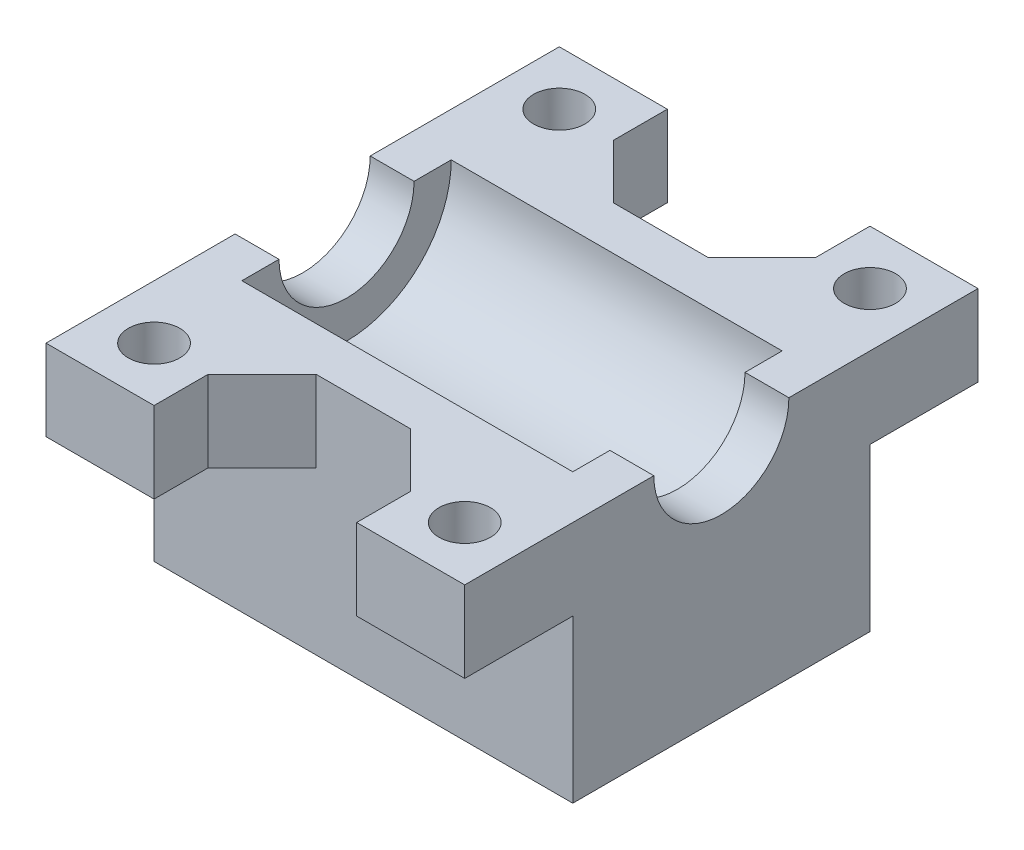
from build123d import *

# Parameters (mm, degrees)
SKETCH1_W                 = 31
SKETCH1_H                 = 22
BOSS_EXTRUDE1_DEPTH       = 11
SKETCH2_W                 = 31
SKETCH2_H                 = 22
SKETCH2_R                 = 4
BOSS_EXTRUDE2_DEPTH       = 7
SKETCH3_W                 = 24.5
SKETCH3_H                 = 15.5
CUT_EXTRUDE1_DEPTH        = 7.75
FILLET1_R                 = 7.75
CUT_EXTRUDE2_DEPTH        = 32.812929761
CUT_EXTRUDE2_DEPTH_BACK   = 32.812929761
SKETCH4_R                 = 5
SKETCH5_W                 = 8
SKETCH5_H                 = 8
SKETCH5_R                 = 1.905800151
BOSS_EXTRUDE3_DEPTH       = 6
CUT_EXTRUDE3_START        = -3
SKETCH6_R                 = 3
SKETCH6_R_2               = 1.905800151
CUT_EXTRUDE3_DEPTH        = 3
MIRROR9_COPY_1_SKETCH_W   = 8
MIRROR9_COPY_1_SKETCH_H   = 8
MIRROR9_COPY_1_SKETCH_R   = 1.905800151
MIRROR9_COPY_1_DEPTH      = 6
MIRROR9_START             = -3
MIRROR9_COPY_2_SKETCH_R   = 3
MIRROR9_COPY_2_SKETCH_R_2 = 1.905800151
MIRROR9_COPY_2_DEPTH      = 3
CHAMFER2_SIZE             = 4
SKETCH7_R                 = 4
BOSS_EXTRUDE4_DEPTH       = 1


with BuildPart() as part:
    # Sketch1 → Boss-Extrude1 (new body)
    with BuildSketch(Plane(origin=(0, 0, 0), x_dir=(1, 0, 0), z_dir=(0, 1, 0))):
        Rectangle(SKETCH1_W, SKETCH1_H)
    extrude(amount=BOSS_EXTRUDE1_DEPTH)

    # Sketch2 → Boss-Extrude2 (add)
    with BuildSketch(Plane(origin=(0, 0, 0), x_dir=(1, 0, 0), z_dir=(0, 1, 0))):
        Rectangle(SKETCH2_W, SKETCH2_H)
        with Locations(Location((0, 0, 0), (0, 0, 270))):
            Circle(SKETCH2_R, mode=Mode.SUBTRACT)
    extrude(amount=-BOSS_EXTRUDE2_DEPTH)

    # Sketch3 → Cut-Extrude1 (cut)
    with BuildSketch(Plane(origin=(0, 11, 0), x_dir=(1, 0, 0), z_dir=(0, 1, 0))):
        Rectangle(SKETCH3_W, SKETCH3_H)
    extrude(amount=-CUT_EXTRUDE1_DEPTH, mode=Mode.SUBTRACT)

    # Fillet1
    fillet1_edges = [part.edges().sort_by_distance(p)[0] for p in [
        (0, 3.25, 7.75),
        (0, 3.25, -7.75),
    ]]
    fillet(fillet1_edges, radius=FILLET1_R - 0.0001)  # a hair under: the kernel refuses the full size

    # Sketch4 → Cut-Extrude2 (cut, two sides: drawn at the far end of the back side and taken through both)
    with BuildSketch(Plane(origin=(-12.25, 0, 0), x_dir=(0, 0, -1), z_dir=(1, 0, 0)).offset(-CUT_EXTRUDE2_DEPTH_BACK)):
        with Locations((0, 11)):
            Circle(SKETCH4_R)
    extrude(amount=CUT_EXTRUDE2_DEPTH + CUT_EXTRUDE2_DEPTH_BACK, mode=Mode.SUBTRACT)

    # Sketch5 → Boss-Extrude3 (add)
    with BuildSketch(Plane(origin=(0, 11, 0), x_dir=(1, 0, 0), z_dir=(0, 1, 0))):
        with Locations((11.5, -15)):
            Rectangle(SKETCH5_W, SKETCH5_H)
        with Locations(Location((11.5, -15, 0), (0, 0, 270))):
            Circle(SKETCH5_R, mode=Mode.SUBTRACT)
    boss_extrude3 = extrude(amount=-BOSS_EXTRUDE3_DEPTH)

    # Sketch6 → Cut-Extrude3 (cut)
    with BuildSketch(Plane.XZ.offset(-5).offset(CUT_EXTRUDE3_START)):
        with Locations(Location((11.5, 15, 0), (0, 0, 270))):
            Circle(SKETCH6_R)
        with Locations(Location((11.5, 15, 0), (0, 0, 90))):
            Circle(SKETCH6_R_2, mode=Mode.SUBTRACT)
    cut_extrude3 = extrude(amount=CUT_EXTRUDE3_DEPTH, mode=Mode.SUBTRACT)

    # Mirror8: Boss-Extrude3, Cut-Extrude3 across plane
    add(boss_extrude3.mirror(Plane(origin=(0, 0, 0), x_dir=(0, 0, 1), z_dir=(1, 0, 0))))
    add(cut_extrude3.mirror(Plane(origin=(0, 0, 0), x_dir=(0, 0, 1), z_dir=(1, 0, 0))), mode=Mode.SUBTRACT)

    # Mirror9: Boss-Extrude3, Cut-Extrude3 across plane
    add(boss_extrude3.mirror(Plane.XY))
    add(cut_extrude3.mirror(Plane.XY), mode=Mode.SUBTRACT)

    # Mirror9 copy 1 sketch → Mirror9 copy 1 (add)
    with BuildSketch(Plane(origin=(0, 11, 0), x_dir=(-1, 0, 0), z_dir=(0, 1, 0))):
        with Locations((11.5, -15)):
            Rectangle(MIRROR9_COPY_1_SKETCH_W, MIRROR9_COPY_1_SKETCH_H)
        with Locations(Location((11.5, -15, 0), (0, 0, 270))):
            Circle(MIRROR9_COPY_1_SKETCH_R, mode=Mode.SUBTRACT)
    extrude(amount=-MIRROR9_COPY_1_DEPTH)

    # Mirror9 copy 2 sketch → Mirror9 copy 2 (cut)
    with BuildSketch(Plane(origin=(0, 5, 0), x_dir=(-1, 0, 0), z_dir=(0, -1, 0)).offset(MIRROR9_START)):
        with Locations(Location((11.5, 15, 0), (0, 0, 270))):
            Circle(MIRROR9_COPY_2_SKETCH_R)
        with Locations(Location((11.5, 15, 0), (0, 0, 90))):
            Circle(MIRROR9_COPY_2_SKETCH_R_2, mode=Mode.SUBTRACT)
    extrude(amount=MIRROR9_COPY_2_DEPTH, mode=Mode.SUBTRACT)

    # Chamfer2
    chamfer2_edges = [part.edges().sort_by_distance(p)[0] for p in [
        (-7.5, 8, -11),
        (7.5, 8, -11),
        (7.5, 8, 11),
        (-7.5, 8, 11),
    ]]
    chamfer(chamfer2_edges, length=CHAMFER2_SIZE)

    # Sketch7 → Boss-Extrude4 (add)
    with BuildSketch(Plane.XZ):
        with Locations(Location((0, 0, 0), (0, 0, 90))):
            Circle(SKETCH7_R)
    extrude(amount=BOSS_EXTRUDE4_DEPTH)


solid = part.part
